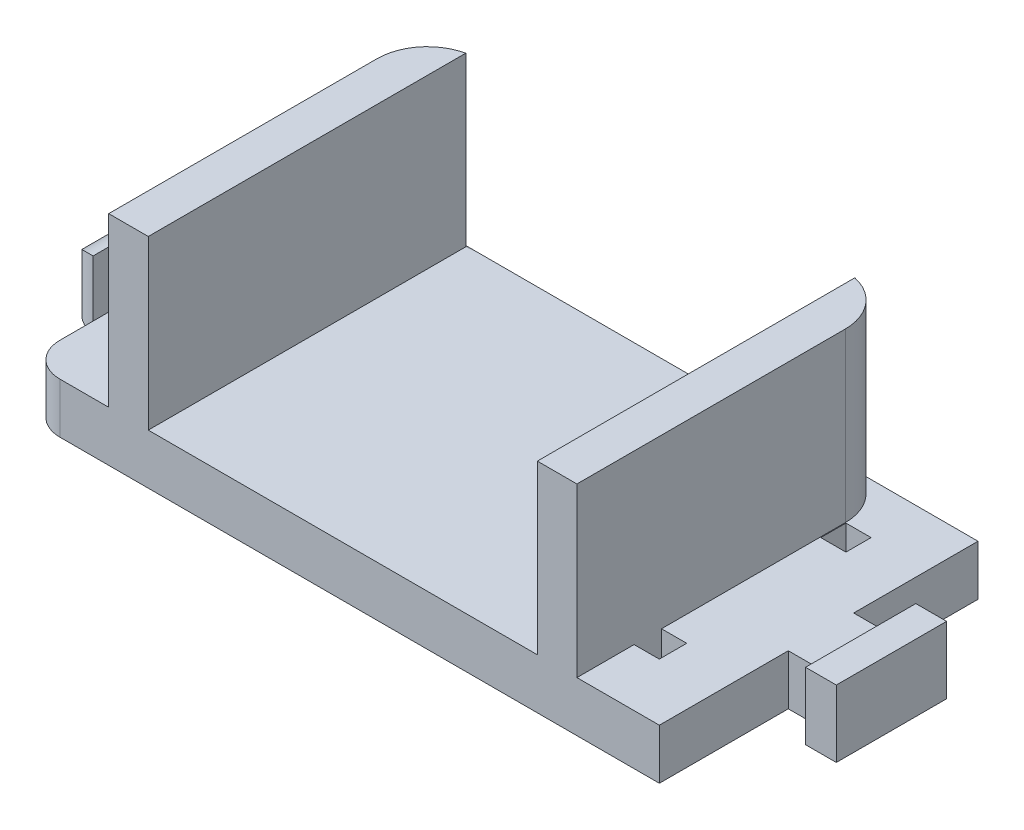
from build123d import *

# Parameters (mm, degrees)
SKETCH1_W           = 37.75025884
SKETCH1_H           = 38
SKETCH1_W_2         = 3
SKETCH1_H_2         = 3
SKETCH1_W_3         = 3.002099817
SKETCH1_H_3         = 3.270956242
SKETCH1_W_4         = 4.73135243
SKETCH1_H_4         = 7.795369176
BOSS_EXTRUDE1_DEPTH = 6
SKETCH2_W           = 4.72004293
SKETCH2_H           = 38
BOSS_EXTRUDE2_DEPTH = 20
FILLET1_R           = 6
SKETCH3_W           = 3.670795438
SKETCH3_H           = 13.153400434
BOSS_EXTRUDE3_DEPTH = 2
MIRROR1_OUTLINE_W   = 3.002099816
MIRROR1_OUTLINE_H   = 3.270956242
MIRROR1_OUTLINE_W_2 = 3
MIRROR1_OUTLINE_H_2 = 3
MIRROR1_DEPTH       = 6
MIRROR1_START       = 6
MIRROR1_2_DEPTH     = 20
MIRROR1_3_OUTLINE_W = 3.670795437
MIRROR1_3_OUTLINE_H = 13.153400434
MIRROR1_3_DEPTH     = 2
FILLET2_R           = 4


# Read off the part's stored shape, not the designer's step: Mirror1
with BuildPart() as part:
    # Sketch1 → Boss-Extrude1 (new body)
    # profile 1 of 3: a face of its own
    with BuildSketch(Plane(origin=(0, 0, 0), x_dir=(1, 0, 0), z_dir=(0, 1, 0))):
        with Locations((4.929687173, 3.539918032)):
            Rectangle(SKETCH1_W, SKETCH1_H)
        with Locations((-5.695183407, 15.039918032)):
            Rectangle(SKETCH1_W_2, SKETCH1_H_2, mode=Mode.SUBTRACT)
        with Locations((-5.616276245, -7.006497188)):
            Rectangle(SKETCH1_W_3, SKETCH1_H_3, mode=Mode.SUBTRACT)
    # profile 2 of 3: a face of its own
    with BuildSketch(Plane(origin=(0, 0, 0), x_dir=(1, 0, 0), z_dir=(0, 1, 0))):
        with Locations((-16.311118462, 3.815370554)):
            Rectangle(SKETCH1_W_4, SKETCH1_H_4)
    # profile 3 of 3: a face of its own
    with BuildSketch(Plane(origin=(0, 0, 0), x_dir=(1, 0, 0), z_dir=(0, 1, 0))):
        Polygon((-18.676794677, -0.082314034), (-18.676794677, 7.713055142), (-18.676794677, 10.392070771), (-22.347590115, 10.392070771), (-22.347590115, -2.761329663), (-18.676794677, -2.761329663), align=None)
    extrude(amount=BOSS_EXTRUDE1_DEPTH)

    # Sketch2 → Boss-Extrude2 (add)
    with BuildSketch(Plane(origin=(0, 6, 0), x_dir=(1, 0, 0), z_dir=(0, 1, 0))):
        with Locations((-1.755204872, 3.539918032)):
            Rectangle(SKETCH2_W, SKETCH2_H)
    extrude(amount=BOSS_EXTRUDE2_DEPTH)

    # Fillet1
    # the kernel refuses this fillet: 6 mm, written as the material it takes off along each edge
    with BuildSketch(Plane(origin=(-4.115226337, 6, -22.539918032), x_dir=(1, 0, 0), z_dir=(0, 1, 0))) as fillet1_piece_1:
        with BuildLine():
            CenterArc((FILLET1_R, -FILLET1_R), FILLET1_R, 90, 90)
            Line((0, -FILLET1_R), (0, 0))
            Line((0, 0), (FILLET1_R, 0))
        make_face()
    extrude(amount=35, mode=Mode.SUBTRACT)

    # Sketch3 → Boss-Extrude3 (add)
    with BuildSketch(Plane(origin=(0, 6, 0), x_dir=(1, 0, 0), z_dir=(0, 1, 0))):
        with Locations((-20.512192396, 3.815370554)):
            Rectangle(SKETCH3_W, SKETCH3_H)
    extrude(amount=BOSS_EXTRUDE3_DEPTH)

    # Mirror1 outline → Mirror1 (add)
    with BuildSketch(Plane(origin=(0, 0, 0), x_dir=(1, 0, 0), z_dir=(0, 1, 0))):
        Polygon((23.804816593, -15.460081968), (61.555075434, -15.460081968), (61.555075434, -0.082314034), (66.286427864, -0.082314034), (66.286427864, -2.761329663), (69.957223301, -2.761329663), (69.957223301, 10.392070771), (66.286427864, 10.392070771), (66.286427864, 7.713055142), (61.555075434, 7.713055142), (61.555075434, 22.539918032), (23.804816593, 22.539918032), align=None)
        with Locations((53.225909432, -7.006497188)):
            Rectangle(MIRROR1_OUTLINE_W, MIRROR1_OUTLINE_H, mode=Mode.SUBTRACT)
        with Locations((53.304816593, 15.039918032)):
            Rectangle(MIRROR1_OUTLINE_W_2, MIRROR1_OUTLINE_H_2, mode=Mode.SUBTRACT)
    extrude(amount=MIRROR1_DEPTH)

    # Mirror1 2 outline → Mirror1 2 (add)
    with BuildSketch(Plane(origin=(0, 0, 0), x_dir=(1, 0, 0), z_dir=(0, 1, 0)).offset(MIRROR1_START)):
        with BuildLine():
            Line((51.724859524, -15.460081968), (51.724859524, 16.539918032))
            ThreePointArc((51.724859524, 16.539918032), (50.398174323, 20.302912689), (47.004816593, 22.401804238))
            Line((47.004816593, 22.401804238), (47.004816593, -15.460081968))
            Line((47.004816593, -15.460081968), (51.724859524, -15.460081968))
        make_face()
    extrude(amount=MIRROR1_2_DEPTH)

    # Mirror1 3 outline → Mirror1 3 (add)
    with BuildSketch(Plane(origin=(0, 0, 0), x_dir=(1, 0, 0), z_dir=(0, 1, 0)).offset(MIRROR1_START)):
        with Locations((68.121825583, 3.815370554)):
            Rectangle(MIRROR1_3_OUTLINE_W, MIRROR1_3_OUTLINE_H)
    extrude(amount=MIRROR1_3_DEPTH)

    # Fillet2
    # the kernel refuses this fillet: 4 mm, written as the material it takes off along each edge
    with BuildSketch(Plane(origin=(-13.945442247, -10, 15.460081968), x_dir=(0, 0, -1), z_dir=(0, 1, 0)), Plane(origin=(-13.945442247, -10, -22.539918032), x_dir=(1, 0, 0), z_dir=(0, 1, 0))) as fillet2_piece_1:
        with BuildLine():
            CenterArc((FILLET2_R, -FILLET2_R), FILLET2_R, 90, 90)
            Line((0, -FILLET2_R), (-FILLET2_R * 0.02, -FILLET2_R))
            Line((-FILLET2_R * 0.02, -FILLET2_R), (-FILLET2_R * 0.02, FILLET2_R * 0.02))
            Line((-FILLET2_R * 0.02, FILLET2_R * 0.02), (FILLET2_R, FILLET2_R * 0.02))
            Line((FILLET2_R, FILLET2_R * 0.02), (FILLET2_R, 0))
        make_face()
    extrude(amount=26, mode=Mode.SUBTRACT)
    with BuildSketch(Plane(origin=(-22.347590115, 17.966075066, 2.761329663), x_dir=(0, 0, -1), z_dir=(0, -1, 0))) as fillet2_piece_2:
        with BuildLine():
            CenterArc((3.986430026, 4), FILLET2_R, 184.720847703, 85.279152297)
            Line((0, 3.670795437), (-0.079728601, 3.664211346))
            ThreePointArc((-0.079728601, 3.664211346), (-0.08, 1.835397719), (-0.08, 0))
            Line((-0.08, 0), (0, -0.08))
            Line((0, -0.08), (3.986430026, -0.08))
            Line((3.986430026, -0.08), (3.986430026, 0))
        make_face()
    extrude(amount=27.932150132, mode=Mode.SUBTRACT)
    with BuildSketch(Plane(origin=(-22.347590115, 8, -20.358145837), x_dir=(0, -1, 0), z_dir=(0, 0, 1))) as fillet2_piece_3:
        with BuildLine():
            CenterArc((3.986430026, 4), FILLET2_R, 184.720847703, 85.279152297)
            Line((0, 3.670795437), (-0.079728601, 3.664211346))
            ThreePointArc((-0.079728601, 3.664211346), (-0.08, 1.835397719), (-0.08, 0))
            Line((-0.08, 0), (0, -0.08))
            Line((0, -0.08), (3.986430026, -0.08))
            Line((3.986430026, -0.08), (3.986430026, 0))
        make_face()
    extrude(amount=33.085550566, mode=Mode.SUBTRACT)
    with BuildSketch(Plane(origin=(-22.347590115, -9.966075066, -10.392070771), x_dir=(1, 0, 0), z_dir=(0, 1, 0))) as fillet2_piece_4:
        with BuildLine():
            CenterArc((4, -3.986430026), FILLET2_R, 94.720847703, 85.279152297)
            Line((0, -3.986430026), (-0.08, -3.986430026))
            Line((-0.08, -3.986430026), (-0.08, 0))
            Line((-0.08, 0), (0, 0.08))
            ThreePointArc((0, 0.08), (1.835397719, 0.08), (3.664211346, 0.079728601))
            Line((3.664211346, 0.079728601), (3.670795437, 0))
        make_face()
    extrude(amount=27.932150132, mode=Mode.SUBTRACT)


solid = part.part
